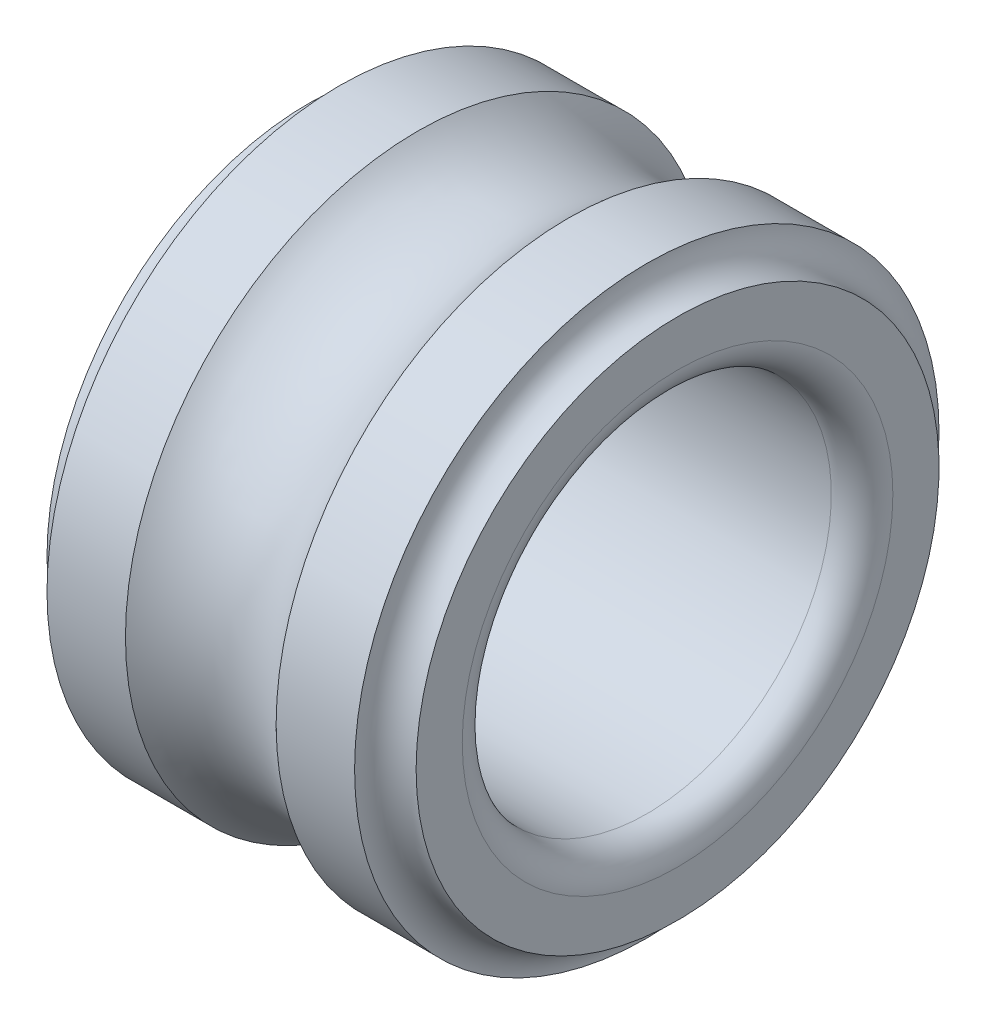
from build123d import *

# Parameters (mm, degrees)
CUT_EXTRUDE1_START = -1
SKETCH3_R          = 9.5
SKETCH3_R_2        = 8.5
CUT_EXTRUDE1_DEPTH = 1
FILLET1_R          = 1


with BuildPart() as part:
    # Sketch2 → Revolve1 (revolve)
    with BuildSketch(Plane.XY, mode=Mode.PRIVATE) as revolve1_sk:
        with BuildLine():
            Line((-6, 9.5), (-2.449489743, 9.5))
            ThreePointArc((-2.449489743, 9.5), (0, 8.5), (2.449489743, 9.5))
            Line((2.449489743, 9.5), (6, 9.5))
            Line((6, 9.5), (6, 7))
            ThreePointArc((6, 7), (5.707106781, 6.292893219), (5, 6))
            Line((5, 6), (-5, 6))
            ThreePointArc((-5, 6), (-5.707106781, 6.292893219), (-6, 7))
            Line((-6, 7), (-6, 9.5))
        make_face()
    revolve(revolve1_sk.sketch.rotate(Axis((-6, 0, 0), (1, 0, 0)), 90), axis=Axis((-6, 0, 0), (1, 0, 0)))

    # Sketch3 → Cut-Extrude1 (cut)
    with BuildSketch(Plane.ZY.offset(6).offset(CUT_EXTRUDE1_START)):
        Circle(SKETCH3_R)
        Circle(SKETCH3_R_2, mode=Mode.SUBTRACT)
    cut_extrude1 = extrude(amount=CUT_EXTRUDE1_DEPTH, mode=Mode.SUBTRACT)

    # Mirror1: Cut-Extrude1 across plane
    add(cut_extrude1.mirror(Plane(origin=(0, 0, 0), x_dir=(0, 0, 1), z_dir=(1, 0, 0))), mode=Mode.SUBTRACT)

    # Fillet1
    fillet1_edges = [part.edges().sort_by_distance(p)[0] for p in [
        (-5, 0, -8.5),
        (5, 0, -8.5),
    ]]
    fillet(fillet1_edges, radius=FILLET1_R - 0.0001)  # a hair under: the kernel refuses the full size


solid = part.part
